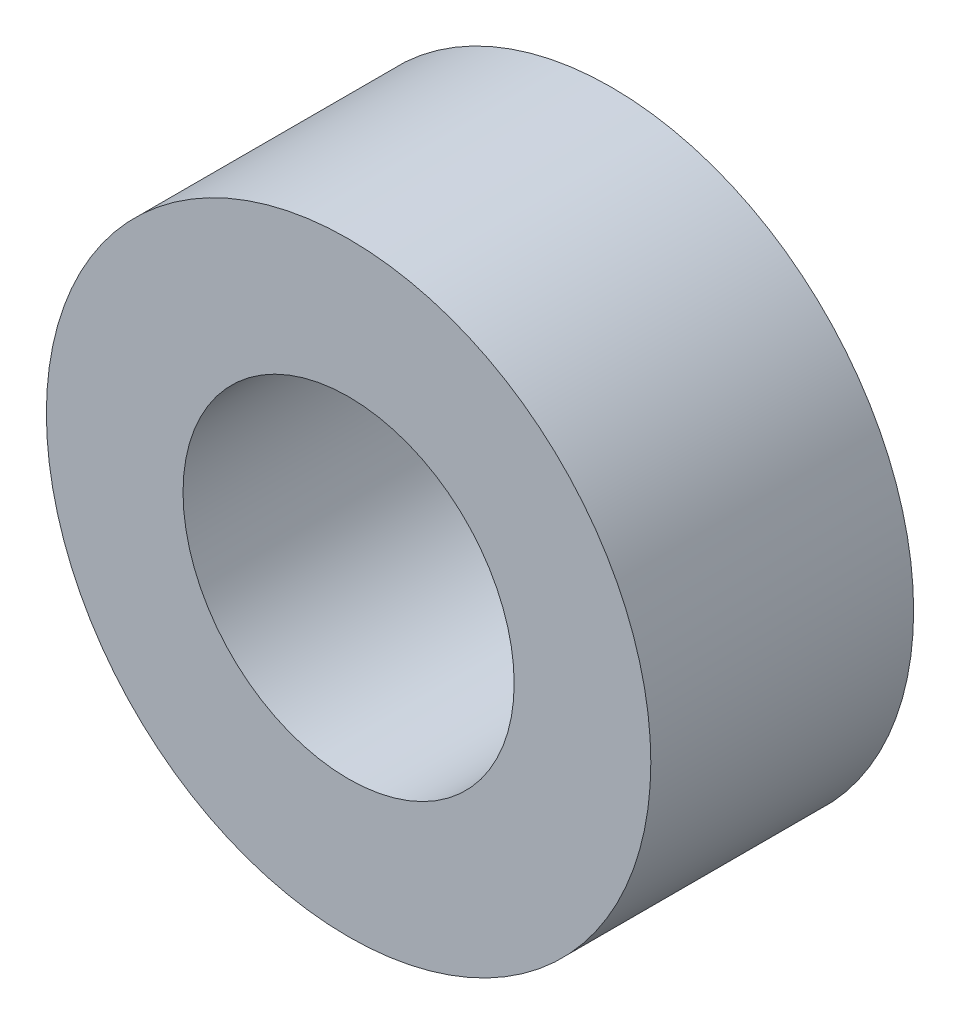
from build123d import *

# Parameters (mm, degrees)
SKETCH1_R           = 2.875
SKETCH1_R_2         = 1.575
BOSS_EXTRUDE1_DEPTH = 2.5


with BuildPart() as part:
    # Sketch1 → Boss-Extrude1 (new body)
    with BuildSketch(Plane.XY):
        Circle(SKETCH1_R)
        Circle(SKETCH1_R_2, mode=Mode.SUBTRACT)
    extrude(amount=BOSS_EXTRUDE1_DEPTH)


solid = part.part
